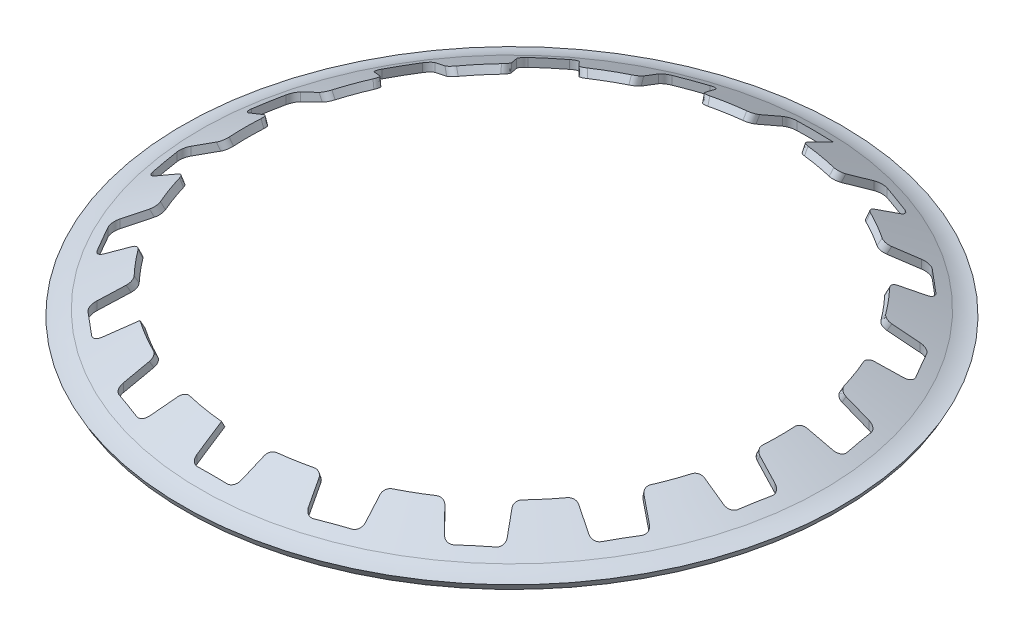
from build123d import *

# Parameters (mm, degrees)
CORTE_EXTRUS_O3_DEPTH      = 79.362242738
CORTE_EXTRUS_O3_DEPTH_BACK = 79.362242738
FILETE1_R                  = 1.25


with BuildPart() as part:
    # Esboço1 → Revolução1 (revolve)
    with BuildSketch(Plane.XY):
        with BuildLine():
            Line((44, 8.420727557), (51.684006852, 4.270561273))
            ThreePointArc((51.684006852, 4.270561273), (53.026000213, 3.826638603), (54.405974918, 3.520561273))
            Line((54.405974918, 3.520561273), (55, 4.620394988))
            ThreePointArc((55, 4.620394988), (53.461837133, 4.943292071), (52, 5.520561273))
            Line((52, 5.520561273), (44.594025082, 9.520561273))
            Line((44.594025082, 9.520561273), (44, 8.420727557))
        make_face()
    revolve(axis=Axis((0, -72.564396456, 0), (0, 1, 0)))

    # Esboço2 → Corte-extrusão3 (cut, two sides: drawn at the far end of the back side and taken through both)
    with BuildSketch(Plane(origin=(0, 0, 0), x_dir=(1, 0, 0), z_dir=(0, 1, 0)).offset(-CORTE_EXTRUS_O3_DEPTH_BACK)):
        Polygon((3.625, 50), (-3.625, 50), (-4.125, 43.411367454), (4.125, 43.411367454), align=None)
        Polygon((20.507392917, 45.74480802), (13.694621416, 48.224454059), (10.971330058, 42.204174746), (18.723794179, 39.382508564), align=None)
        Polygon((34.916291591, 35.972117071), (29.362469378, 40.632327241), (24.744355791, 35.906535696), (31.064222447, 30.603537916), align=None)
        Polygon((45.113770189, 21.860657911), (41.488770189, 28.139342089), (35.532847028, 25.278038518), (39.657847028, 18.133328936), align=None)
        Polygon((49.869862295, 5.112480779), (48.610913007, 12.252336988), (42.035552505, 11.60063683), (43.468149971, 3.475972867), align=None)
        Polygon((48.610913007, -12.252336988), (49.869862295, -5.112480779), (43.468149971, -3.475972867), (42.035552505, -11.60063683), align=None)
        Polygon((41.488770189, -28.139342089), (45.113770189, -21.860657911), (39.657847028, -18.133328936), (35.532847028, -25.278038518), align=None)
        Polygon((29.362469378, -40.632327241), (34.916291591, -35.972117071), (31.064222447, -30.603537916), (24.744355791, -35.906535696), align=None)
        Polygon((13.694621416, -48.224454059), (20.507392917, -45.74480802), (18.723794179, -39.382508564), (10.971330058, -42.204174746), align=None)
        Polygon((-3.625, -50), (3.625, -50), (4.125, -43.411367454), (-4.125, -43.411367454), align=None)
        Polygon((-20.507392917, -45.74480802), (-13.694621416, -48.224454059), (-10.971330058, -42.204174746), (-18.723794179, -39.382508564), align=None)
        Polygon((-34.916291591, -35.972117071), (-29.362469378, -40.632327241), (-24.744355791, -35.906535696), (-31.064222447, -30.603537916), align=None)
        Polygon((-45.113770189, -21.860657911), (-41.488770189, -28.139342089), (-35.532847028, -25.278038518), (-39.657847028, -18.133328936), align=None)
        Polygon((-49.869862295, -5.112480779), (-48.610913007, -12.252336988), (-42.035552505, -11.60063683), (-43.468149971, -3.475972867), align=None)
        Polygon((-48.610913007, 12.252336988), (-49.869862295, 5.112480779), (-43.468149971, 3.475972867), (-42.035552505, 11.60063683), align=None)
        Polygon((-41.488770189, 28.139342089), (-45.113770189, 21.860657911), (-39.657847028, 18.133328936), (-35.532847028, 25.278038518), align=None)
        Polygon((-29.362469378, 40.632327241), (-34.916291591, 35.972117071), (-31.064222447, 30.603537916), (-24.744355791, 35.906535696), align=None)
        Polygon((-13.694621416, 48.224454059), (-20.507392917, 45.74480802), (-18.723794179, 39.382508564), (-10.971330058, 42.204174746), align=None)
    extrude(amount=CORTE_EXTRUS_O3_DEPTH + CORTE_EXTRUS_O3_DEPTH_BACK, mode=Mode.SUBTRACT)

    # Filete1
    filete1_edges = [part.edges().sort_by_distance(p)[0] for p in [
        (4.072023907, 8.970632204, -44.109447481),
        (-3.625, 5.819555436, -50),
        (11.259868733, 8.970632204, -42.842036505),
        (13.694621416, 5.819555436, -48.224454059),
        (20.507392917, 5.819555436, -45.74480802),
        (18.912770366, 8.970632204, -40.056608105),
        (25.233655025, 8.970632204, -36.407243646),
        (29.362469378, 5.819555436, -40.632327241),
        (34.916291591, 5.819555436, -35.972117071),
        (31.472357597, 8.970632204, -31.172350619),
        (36.163890112, 8.970632204, -25.581199888),
        (41.488770189, 5.819555436, -28.139342089),
        (45.113770189, 5.819555436, -21.860657911),
        (40.235914019, 8.970632204, -18.528247593),
        (42.73222633, 8.970632204, -11.669685887),
        (48.610913007, 5.819555436, -12.252336988),
        (49.869862295, 5.819555436, -5.112480779),
        (44.146425391, 8.970632204, -3.649364459),
        (44.146425391, 8.970632204, 3.649364459),
        (49.869862295, 5.819555436, 5.112480779),
        (48.610913007, 5.819555436, 12.252336988),
        (42.73222633, 8.970632204, 11.669685887),
        (40.235914019, 8.970632204, 18.528247593),
        (45.113770189, 5.819555436, 21.860657911),
        (41.488770189, 5.819555436, 28.139342089),
        (36.163890112, 8.970632204, 25.581199888),
        (31.472357597, 8.970632204, 31.172350619),
        (34.916291591, 5.819555436, 35.972117071),
        (29.362469378, 5.819555436, 40.632327241),
        (25.233655025, 8.970632204, 36.407243646),
        (18.912770366, 8.970632204, 40.056608105),
        (20.507392917, 5.819555436, 45.74480802),
        (13.694621416, 5.819555436, 48.224454059),
        (11.259868733, 8.970632204, 42.842036505),
        (4.072023907, 8.970632204, 44.109447481),
        (3.625, 5.819555436, 50),
        (-3.625, 5.819555436, 50),
        (-11.259868733, 8.970632204, 42.842036505),
        (-13.694621416, 5.819555436, 48.224454059),
        (-20.507392917, 5.819555436, 45.74480802),
        (-18.912770366, 8.970632204, 40.056608105),
        (-29.362469378, 5.819555436, 40.632327241),
        (-34.916291591, 5.819555436, 35.972117071),
        (-31.472357597, 8.970632204, 31.172350619),
        (-36.163890112, 8.970632204, 25.581199888),
        (-41.488770189, 5.819555436, 28.139342089),
        (-45.113770189, 5.819555436, 21.860657911),
        (-40.235914019, 8.970632204, 18.528247593),
        (-42.73222633, 8.970632204, 11.669685887),
        (-48.610913007, 5.819555436, 12.252336988),
        (-49.869862295, 5.819555436, 5.112480779),
        (-44.146425391, 8.970632204, 3.649364459),
        (-44.146425391, 8.970632204, -3.649364459),
        (-49.869862295, 5.819555436, -5.112480779),
        (-48.610913007, 5.819555436, -12.252336988),
        (-42.73222633, 8.970632204, -11.669685887),
        (-40.235914019, 8.970632204, -18.528247593),
        (-45.113770189, 5.819555436, -21.860657911),
        (-41.488770189, 5.819555436, -28.139342089),
        (-36.163890112, 8.970632204, -25.581199888),
        (-31.472357597, 8.970632204, -31.172350619),
        (-34.916291591, 5.819555436, -35.972117071),
        (-29.362469378, 5.819555436, -40.632327241),
        (-25.233655025, 8.970632204, -36.407243646),
        (-18.912770366, 8.970632204, -40.056608105),
        (-20.507392917, 5.819555436, -45.74480802),
        (-13.694621416, 5.819555436, -48.224454059),
        (-4.072023907, 8.970632204, -44.109447481),
        (-11.259868733, 8.970632204, -42.842036505),
    ]]
    fillet(filete1_edges, radius=FILETE1_R)


solid = part.part
